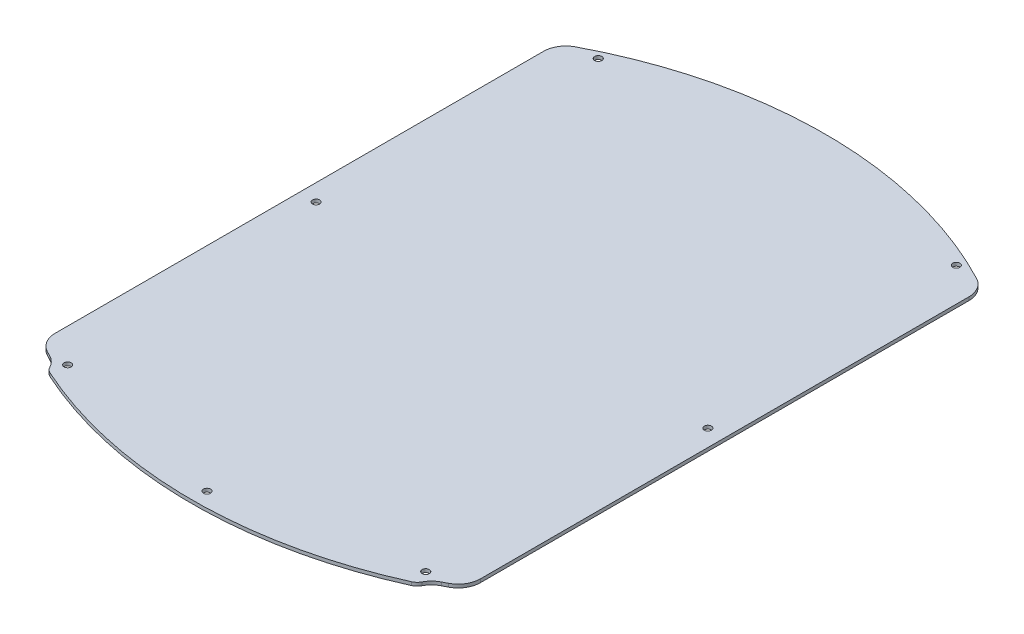
from build123d import *

# Parameters (mm, degrees)
BASE_FLANGE1_DEPTH = 1.5
TAB1_DEPTH         = 1.5
FILLET1_R          = 10
FILLET2_R          = 5
SKETCH9_R          = 1.6
CUT_EXTRUDE1_DEPTH = 172.686487668


# Sheet-metal steps are written as plain solids
with BuildPart() as part:
    # Base-Flange1: sheet metal written as solids
    # Sketch1 → Base-Flange1 (new body)
    with BuildSketch(Plane(origin=(0, 0, 0), x_dir=(1, 0, 0), z_dir=(0, 1, 0))):
        with BuildLine():
            Line((95, -115), (95, 115))
            ThreePointArc((95, 115), (0, 140), (-95, 115))
            Line((-95, 115), (-95, -115))
            ThreePointArc((-95, -115), (0, -140), (95, -115))
        make_face()
    extrude(amount=-BASE_FLANGE1_DEPTH)

    # Tab1: sheet metal written as solids
    # Sketch2 → Tab1 (add)
    with BuildSketch(Plane(origin=(0, 0, 0), x_dir=(1, 0, 0), z_dir=(0, 1, 0))):
        with BuildLine():
            Line((-82.5, -124.791310249), (-82.5, -121.478508705))
            ThreePointArc((-82.5, -121.478508705), (0, -140), (82.5, -121.478508705))
            Line((82.5, -121.478508705), (82.5, -124.791310249))
            ThreePointArc((82.5, -124.791310249), (0, -143), (-82.5, -124.791310249))
        make_face()
    extrude(amount=-TAB1_DEPTH)

    # Fillet1
    # the kernel refuses this fillet: 10 mm, written as the material it adds along each edge
    with BuildSketch(Plane(origin=(-82.5, 0, 121.478508705), x_dir=(-0.8978334247322157, 0, -0.4403352602661074), z_dir=(0, -1, 0))) as fillet1_piece_1:
        with BuildLine():
            CenterArc((5.658454261, -9.998979067), FILLET1_R, 90.818728741, 44.556283737)
            Line((-1.45874333, -2.974343955), (0, 0))
            ThreePointArc((0, 0), (2.757782001, -0.019704015), (5.515564002, 0))
        make_face()
    extrude(amount=1.5)
    with BuildSketch(Plane(origin=(82.5, 0, 121.478508705), x_dir=(0.8978334247322127, 0, -0.44033526026611364), z_dir=(0, -1, 0))) as fillet1_piece_2:
        with BuildLine():
            CenterArc((5.658454261, 9.998979067), FILLET1_R, 224.624987522, 44.556283737)
            Line((-1.45874333, 2.974343955), (0, 0))
            ThreePointArc((0, 0), (2.757782001, 0.019704015), (5.515564002, 0))
        make_face()
    extrude(amount=1.5)
    # the kernel refuses this fillet: 10 mm, written as the material it takes off along each edge
    with BuildSketch(Plane(origin=(-95, 15.245934007, 115), x_dir=(0, 0, -1), z_dir=(0, -1, 0))) as fillet1_2_piece_1:
        with BuildLine():
            CenterArc((5.938283361, 10), FILLET1_R, 207.676630301, 62.323369699)
            ThreePointArc((-2.917548149, 5.355191257), (-1.479926921, 2.6660714), (0, 0))
            Line((0, 0), (5.938283361, 0))
        make_face()
    extrude(amount=31.991868015, mode=Mode.SUBTRACT)
    with BuildSketch(Plane(origin=(95, 15.245934007, 115), x_dir=(0, 0, -1), z_dir=(0, -1, 0)), Plane(origin=(-95, 15.245934007, -115), x_dir=(0, 0, 1), z_dir=(0, -1, 0))) as fillet1_2_piece_2:
        with BuildLine():
            CenterArc((5.938283361, -10), FILLET1_R, 90, 62.323369699)
            ThreePointArc((-2.917548149, -5.355191257), (-1.479926921, -2.6660714), (0, 0))
            Line((0, 0), (5.938283361, 0))
        make_face()
    extrude(amount=31.991868015, mode=Mode.SUBTRACT)
    with BuildSketch(Plane(origin=(95, 15.245934007, -115), x_dir=(-0.8781343363797829, 0, -0.47841413782500014), z_dir=(0, -1, 0))) as fillet1_2_piece_3:
        with BuildLine():
            CenterArc((5.94038465, -9.998751897), FILLET1_R, 89.094752314, 62.323369699)
            Line((-2.840958714, -5.214610518), (0, 0))
            ThreePointArc((0, 0), (3.049186801, 0.024088395), (6.098373603, 0))
        make_face()
    extrude(amount=31.991868015, mode=Mode.SUBTRACT)

    # Fillet2
    fillet2_edges = [part.edges().sort_by_distance(p)[0] for p in [
        (82.5, -0.75, 124.791310249),
        (-82.5, -0.75, 124.791310249),
    ]]
    fillet(fillet2_edges, radius=FILLET2_R)

    # Sketch9 → Cut-Extrude1 (cut, through all)
    with BuildSketch(Plane(origin=(0, 0, 0), x_dir=(1, 0, 0), z_dir=(0, 1, 0))):
        with Locations(Location((-79.980506034, 118.518748697, 0), (0, 0, 270))):
            Circle(SKETCH9_R)
        with Locations(Location((79.980506034, 118.518748697, 0), (0, 0, 270))):
            Circle(SKETCH9_R)
        with Locations(Location((-79.980506034, -118.518748697, 0), (0, 0, 270))):
            Circle(SKETCH9_R)
        with Locations(Location((0, -136.25, 0), (0, 0, 270))):
            Circle(SKETCH9_R)
        with Locations(Location((79.980506034, -118.518748697, 0), (0, 0, 270))):
            Circle(SKETCH9_R)
        with Locations(Location((87.5, 0, 0), (0, 0, 270))):
            Circle(SKETCH9_R)
        with Locations(Location((-87.5, 0, 0), (0, 0, 270))):
            Circle(SKETCH9_R)
    extrude(amount=-CUT_EXTRUDE1_DEPTH, mode=Mode.SUBTRACT)


solid = part.part
